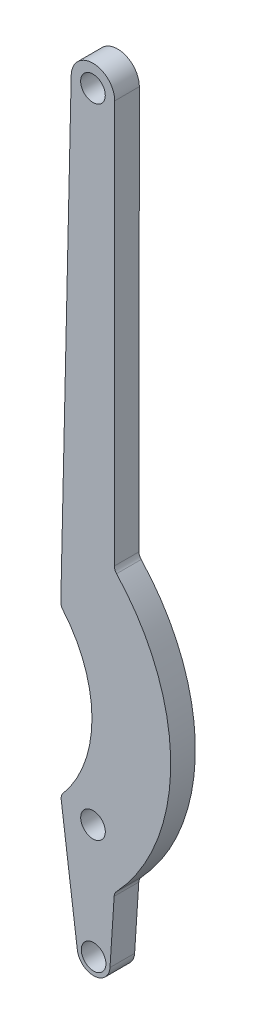
from build123d import *

# Parameters (mm, degrees)
SKETCH_1_R      = 1.5
EXTRUDE_1_DEPTH = 3


with BuildPart() as part:
    # 草图1 → 凸台-拉伸1 (new body)
    with BuildSketch(Plane.XY):
        with BuildLine():
            Line((-1.982814192, -0.26162546), (-3.94500514, 14.609480978))
            ThreePointArc((-3.94500514, 14.609480978), (-3.913530536, 15.020525062), (-3.71891743, 15.383944419))
            ThreePointArc((-3.71891743, 15.383944419), (-0.198738851, 25.069024068), (-3.758040813, 34.739794181))
            ThreePointArc((-3.758040813, 34.739794181), (-3.937957309, 35.052687527), (-3.995075635, 35.409071714))
            Line((-3.995075635, 35.409071714), (-2.727846948, 91.620455333))
            ThreePointArc((-2.727846948, 91.620455333), (-0.048061084, 94.209960909), (2.570279979, 91.558342256))
            Line((2.570279979, 91.558342256), (2.525818517, 42.480676737))
            ThreePointArc((2.525818517, 42.480676737), (2.595130878, 42.113954881), (2.794077848, 41.798187203))
            ThreePointArc((2.794077848, 41.798187203), (9.390318933, 25.020403819), (2.769110226, 8.252458))
            ThreePointArc((2.769110226, 8.252458), (2.582020119, 7.966794332), (2.501953148, 7.634836926))
            Line((2.501953148, 7.634836926), (1.99576388, -0.130102022))
            ThreePointArc((1.99576388, -0.130102022), (0.066079704, -1.99890807), (-1.982814192, -0.26162546))
        make_face()
        Circle(SKETCH_1_R, mode=Mode.SUBTRACT)
        with Locations((-0.07911944, 91.560742455)):
            Circle(SKETCH_1_R, mode=Mode.SUBTRACT)
        with Locations((-0.073800571, 13.899599644)):
            Circle(SKETCH_1_R, mode=Mode.SUBTRACT)
    extrude(amount=EXTRUDE_1_DEPTH)


solid = part.part
